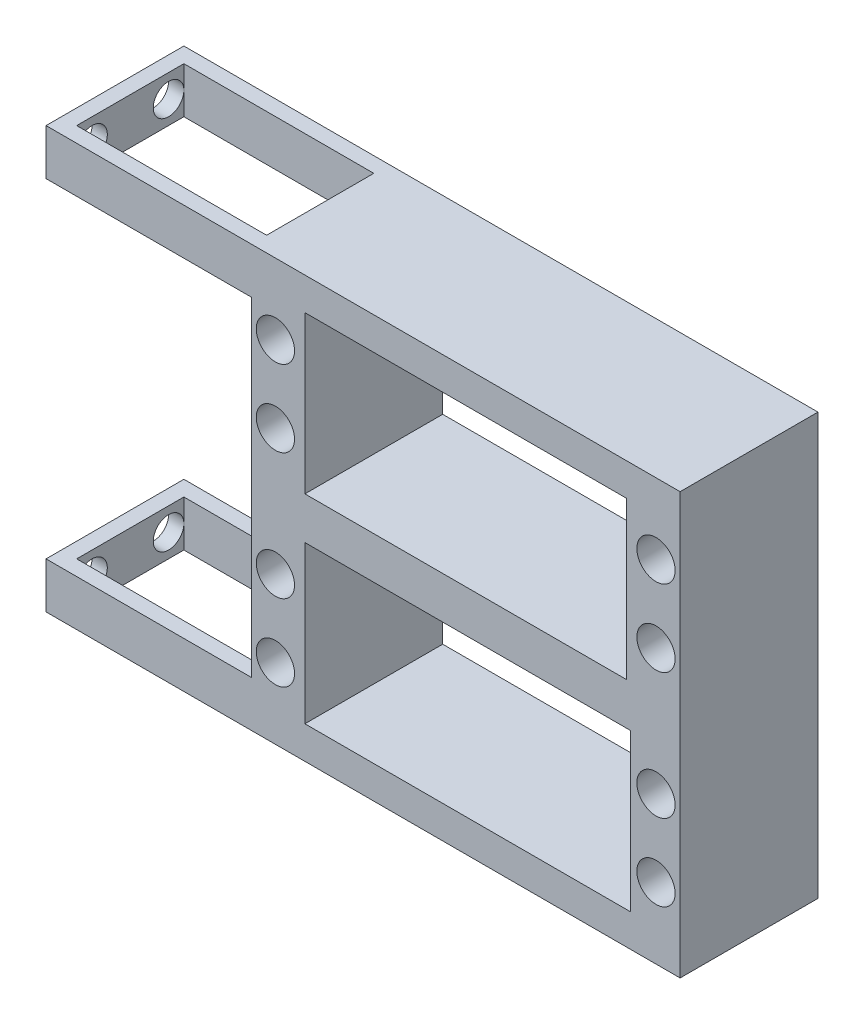
from build123d import *

# Parameters (mm, degrees)
SKETCH2_W           = 56
SKETCH2_H           = 55
SKETCH2_W_2         = 42
SKETCH2_H_2         = 20.5
SKETCH2_W_3         = 42.5
BOSS_EXTRUDE1_DEPTH = 18
SKETCH3_R           = 2.5
CUT_EXTRUDE1_DEPTH  = 10
SKETCH5_W           = 2
SKETCH5_H           = 6
BOSS_EXTRUDE2_DEPTH = 26.8
BOSS_EXTRUDE3_REACH = 82.106
SKETCH6_W           = 2
SKETCH6_H           = 6
SKETCH7_R           = 2
CUT_EXTRUDE2_DEPTH  = 10


with BuildPart() as part:
    # Sketch2 → Boss-Extrude1 (new body)
    with BuildSketch(Plane.XY):
        with Locations((28, 27.5)):
            Rectangle(SKETCH2_W, SKETCH2_H)
        with Locations((28, 40.5)):
            Rectangle(SKETCH2_W_2, SKETCH2_H_2, mode=Mode.SUBTRACT)
        with Locations((28.25, 14.5)):
            Rectangle(SKETCH2_W_3, SKETCH2_H_2, mode=Mode.SUBTRACT)
    extrude(amount=BOSS_EXTRUDE1_DEPTH)

    # Sketch3 → Cut-Extrude1 (cut)
    with BuildSketch(Plane.XY.offset(18)):
        with Locations((3.15, 45.75)):
            Circle(SKETCH3_R)
        with Locations((3.15, 35.75)):
            Circle(SKETCH3_R)
        with Locations((52.85, 35.75)):
            Circle(SKETCH3_R)
        with Locations((52.85, 45.75)):
            Circle(SKETCH3_R)
        with Locations((3.15, 19.25)):
            Circle(SKETCH3_R)
        with Locations((3.15, 9.25)):
            Circle(SKETCH3_R)
        with Locations((52.85, 9.25)):
            Circle(SKETCH3_R)
        with Locations((52.85, 19.25)):
            Circle(SKETCH3_R)
    extrude(amount=-CUT_EXTRUDE1_DEPTH, mode=Mode.SUBTRACT)

    # Sketch5 → Boss-Extrude2 (add)
    with BuildSketch(Plane.ZY):
        with Locations((1, 52)):
            Rectangle(SKETCH5_W, SKETCH5_H)
        with Locations((17, 52)):
            Rectangle(SKETCH5_W, SKETCH5_H)
        with Locations((1, 3)):
            Rectangle(SKETCH5_W, SKETCH5_H)
        with Locations((17, 3)):
            Rectangle(SKETCH5_W, SKETCH5_H)
    extrude(amount=BOSS_EXTRUDE2_DEPTH)

    # Sketch6 → Boss-Extrude3 (add, up to next)
    with BuildSketch(Plane.XY.offset(2), mode=Mode.PRIVATE) as boss_extrude3_sk1:
        with Locations((-25.8, 52)):
            Rectangle(SKETCH6_W, SKETCH6_H)
    boss_extrude3_tool1 = extrude(boss_extrude3_sk1.sketch, amount=BOSS_EXTRUDE3_REACH, mode=Mode.PRIVATE) - part.part
    # Sketch6 → Boss-Extrude3 (add, up to next)
    with BuildSketch(Plane.XY.offset(2), mode=Mode.PRIVATE) as boss_extrude3_sk2:
        with Locations((-25.8, 3)):
            Rectangle(SKETCH6_W, SKETCH6_H)
    boss_extrude3_tool2 = extrude(boss_extrude3_sk2.sketch, amount=BOSS_EXTRUDE3_REACH, mode=Mode.PRIVATE) - part.part
    add(boss_extrude3_tool1.solids().sort_by_distance((-25.8, 52, 2))[0])
    add(boss_extrude3_tool2.solids().sort_by_distance((-25.8, 3, 2))[0])

    # Sketch7 → Cut-Extrude2 (cut)
    with BuildSketch(Plane.ZY.offset(26.8)):
        with Locations((4, 52)):
            Circle(SKETCH7_R)
        with Locations((14, 52)):
            Circle(SKETCH7_R)
        with Locations((4, 3)):
            Circle(SKETCH7_R)
        with Locations((14, 3)):
            Circle(SKETCH7_R)
    extrude(amount=-CUT_EXTRUDE2_DEPTH, mode=Mode.SUBTRACT)


solid = part.part
